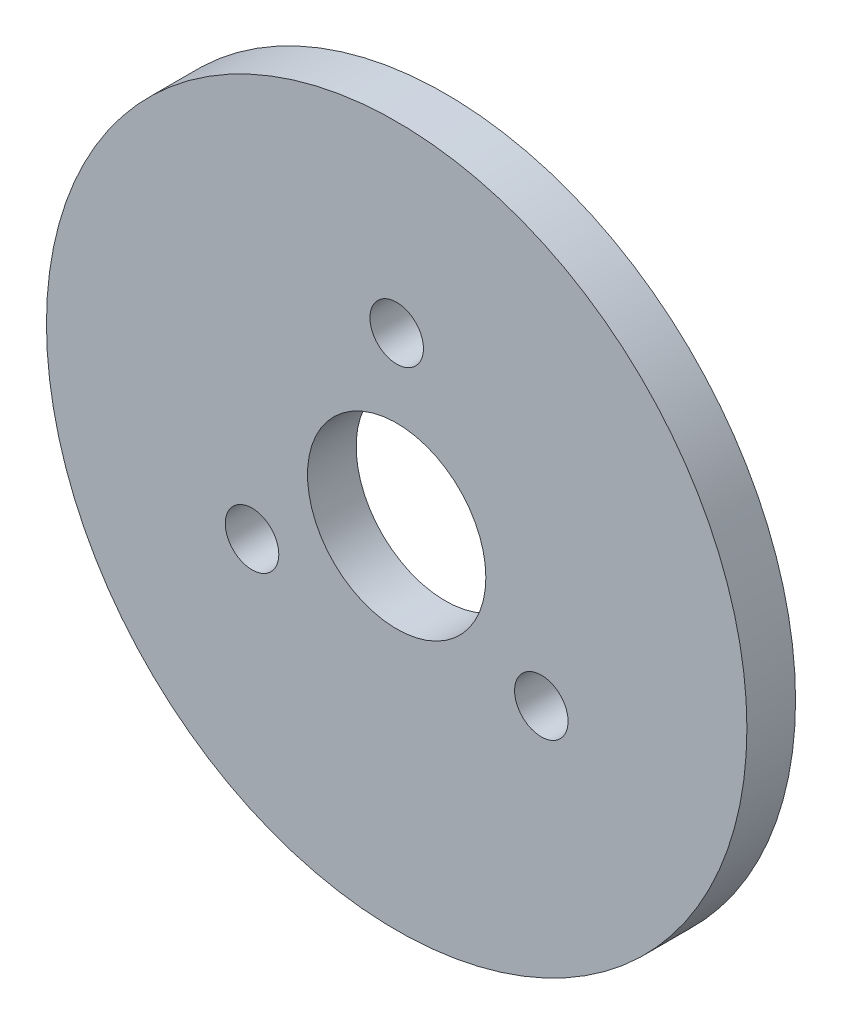
from build123d import *

# Parameters (mm, degrees)
SKETCH1_R           = 21.6
SKETCH1_R_2         = 5.5
BOSS_EXTRUDE1_DEPTH = 3
SKETCH2_R           = 1.65
CUT_EXTRUDE1_DEPTH  = 3


with BuildPart() as part:
    # Sketch1 → Boss-Extrude1 (new body)
    with BuildSketch(Plane.XY):
        Circle(SKETCH1_R)
        Circle(SKETCH1_R_2, mode=Mode.SUBTRACT)
    extrude(amount=BOSS_EXTRUDE1_DEPTH)

    # Sketch2 → Cut-Extrude1 (cut)
    with BuildSketch(Plane.XY.offset(3)):
        with Locations((0, 10.3)):
            Circle(SKETCH2_R)
        with Locations((8.920061659, -5.15)):
            Circle(SKETCH2_R)
        with Locations((-8.920061659, -5.15)):
            Circle(SKETCH2_R)
    extrude(amount=-CUT_EXTRUDE1_DEPTH, mode=Mode.SUBTRACT)


solid = part.part
